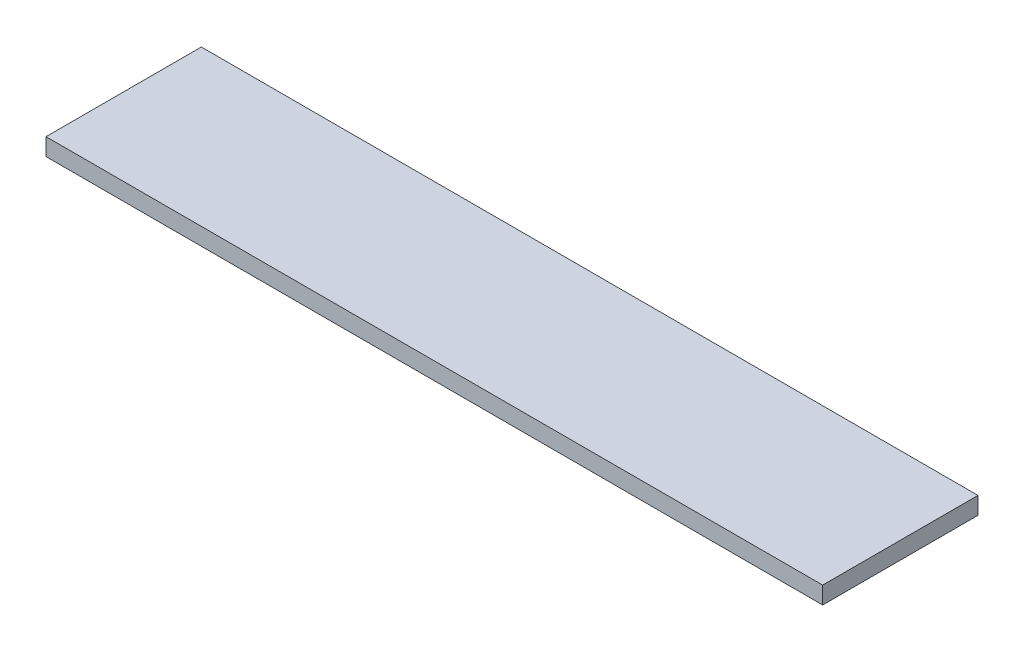
from build123d import *

# Parameters (mm, degrees)
SKETCH8_W          = 450
SKETCH8_H          = 10
BASE_FLANGE1_DEPTH = 45


# Sheet-metal steps are written as plain solids
with BuildPart() as part:
    # Sketch8 → Base-Flange1 (new, symmetric)
    with BuildSketch(Plane.XY):
        with Locations((-225, 5)):
            Rectangle(SKETCH8_W, SKETCH8_H)
    extrude(amount=BASE_FLANGE1_DEPTH, both=True)


solid = part.part
